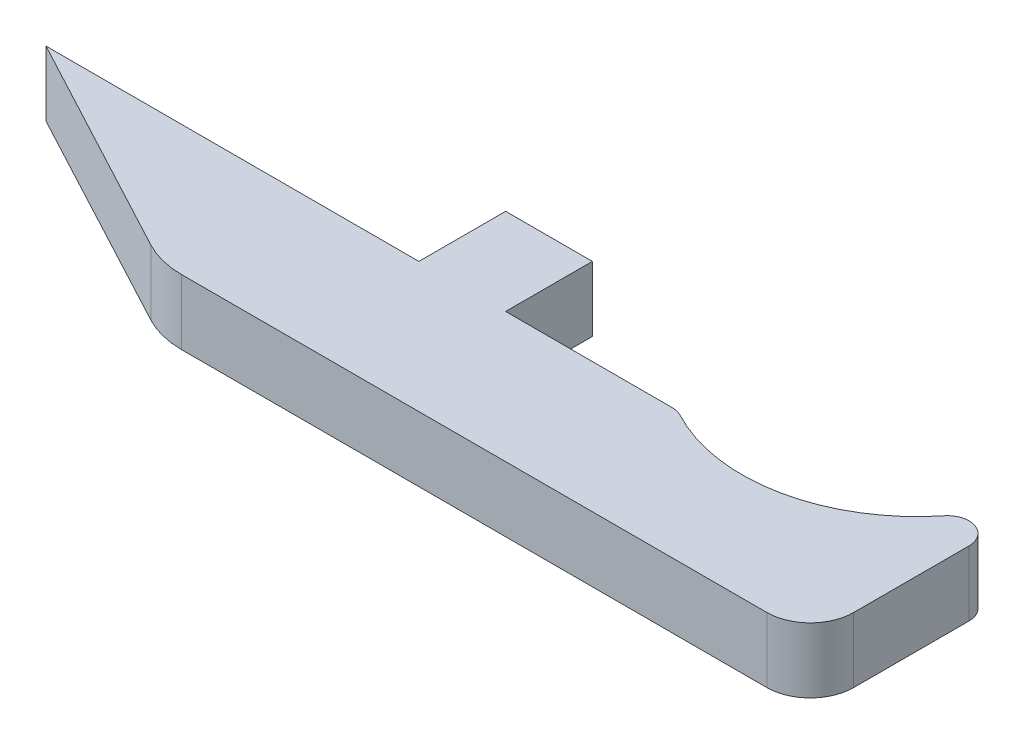
from build123d import *

# Parameters (mm, degrees)
BOSS_EXTRUDE1_DEPTH = 4.7625
FILLET1_R           = 1.5875
FILLET2_R           = 6.35
FILLET3_R           = 3.175
SKETCH2_W           = 6.35
SKETCH2_H           = 4.7625
BOSS_EXTRUDE2_DEPTH = 6.35


with BuildPart() as part:
    # Sketch1 → Boss-Extrude1 (new body)
    with BuildSketch(Plane(origin=(0, 0, 0), x_dir=(1, 0, 0), z_dir=(0, 1, 0))):
        with BuildLine():
            Line((52.558738922, -45.868730992), (33.5895, -45.868730992))
            Line((33.5895, -45.868730992), (6.2845, -45.868730992))
            Line((6.2845, -45.868730992), (24.145239996, -55.393730992))
            Line((24.145239996, -55.393730992), (71.770239996, -55.393730992))
            Line((71.770239996, -55.393730992), (71.770239996, -34.743530992))
            ThreePointArc((71.770239996, -34.743530992), (65.371223106, -45.84366442), (52.558738922, -45.868730992))
        make_face()
    extrude(amount=BOSS_EXTRUDE1_DEPTH)

    # Fillet1
    fillet1_edges = [part.edges().sort_by_distance(p)[0] for p in [
        (52.558738922, 2.38125, 45.868730992),
        (71.770239996, 2.38125, 34.743530992),
    ]]
    fillet(fillet1_edges, radius=FILLET1_R)

    # Fillet2
    fillet2_edges = [part.edges().sort_by_distance(p)[0] for p in [
        (24.145239996, 2.38125, 55.393730992),
    ]]
    fillet(fillet2_edges, radius=FILLET2_R)

    # Fillet3
    fillet3_edges = [part.edges().sort_by_distance(p)[0] for p in [
        (71.770239996, 2.38125, 55.393730992),
    ]]
    fillet(fillet3_edges, radius=FILLET3_R)

    # Sketch2 → Boss-Extrude2 (add)
    with BuildSketch(Plane(origin=(0, 0, 45.868730992), x_dir=(-1, 0, 0), z_dir=(0, 0, -1))):
        with Locations((-36.7645, 2.38125)):
            Rectangle(SKETCH2_W, SKETCH2_H)
    extrude(amount=BOSS_EXTRUDE2_DEPTH)


solid = part.part
